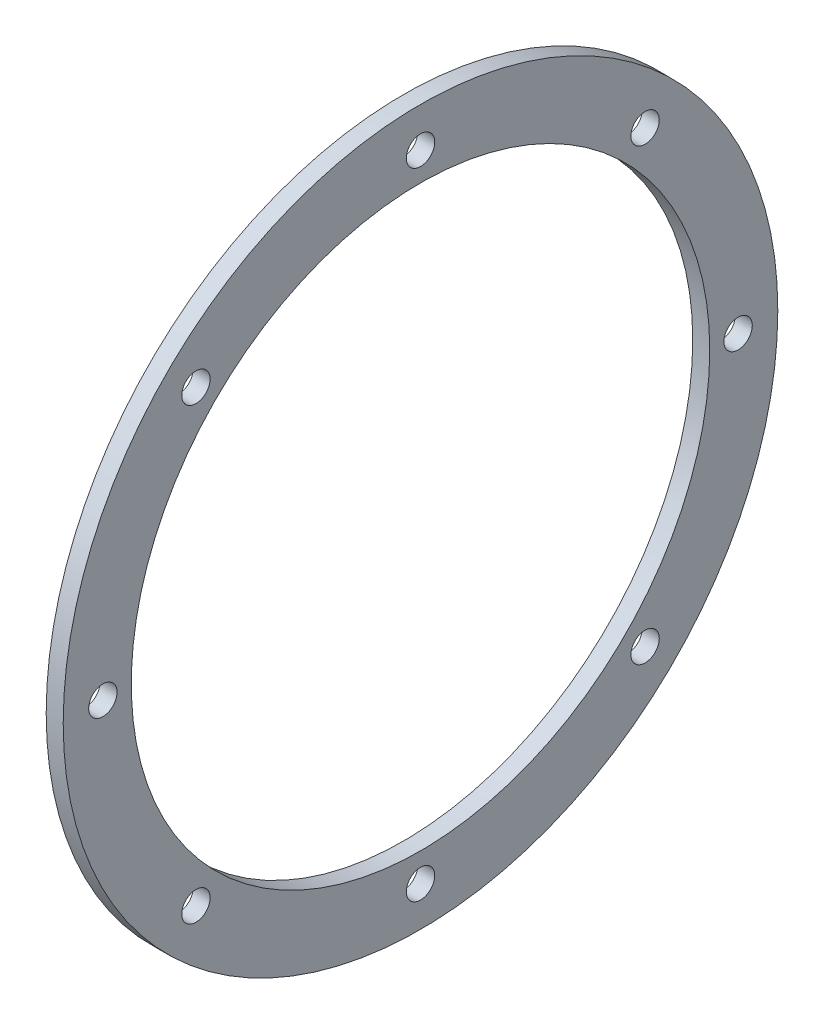
from build123d import *

# Parameters (mm, degrees)
SZKIC1_R                    = 63
SZKIC1_R_2                  = 51
SZKIC1_R_3                  = 2.5
DODANIE_WYCI_GNI_CIE1_DEPTH = 3


with BuildPart() as part:
    # Szkic1 → Dodanie-wyciągnięcie1 (new body)
    with BuildSketch(Plane(origin=(0, 0, 0), x_dir=(0, 0, -1), z_dir=(1, 0, 0))):
        Circle(SZKIC1_R)
        Circle(SZKIC1_R_2, mode=Mode.SUBTRACT)
        with Locations((0, 56)):
            Circle(SZKIC1_R_3, mode=Mode.SUBTRACT)
        with Locations((39.597979746, 39.597979746)):
            Circle(SZKIC1_R_3, mode=Mode.SUBTRACT)
        with Locations((56, 0)):
            Circle(SZKIC1_R_3, mode=Mode.SUBTRACT)
        with Locations((39.597979746, -39.597979746)):
            Circle(SZKIC1_R_3, mode=Mode.SUBTRACT)
        with Locations((0, -56)):
            Circle(SZKIC1_R_3, mode=Mode.SUBTRACT)
        with Locations((-39.597979746, -39.597979746)):
            Circle(SZKIC1_R_3, mode=Mode.SUBTRACT)
        with Locations((-56, 0)):
            Circle(SZKIC1_R_3, mode=Mode.SUBTRACT)
        with Locations((-39.597979746, 39.597979746)):
            Circle(SZKIC1_R_3, mode=Mode.SUBTRACT)
    extrude(amount=DODANIE_WYCI_GNI_CIE1_DEPTH)


solid = part.part
